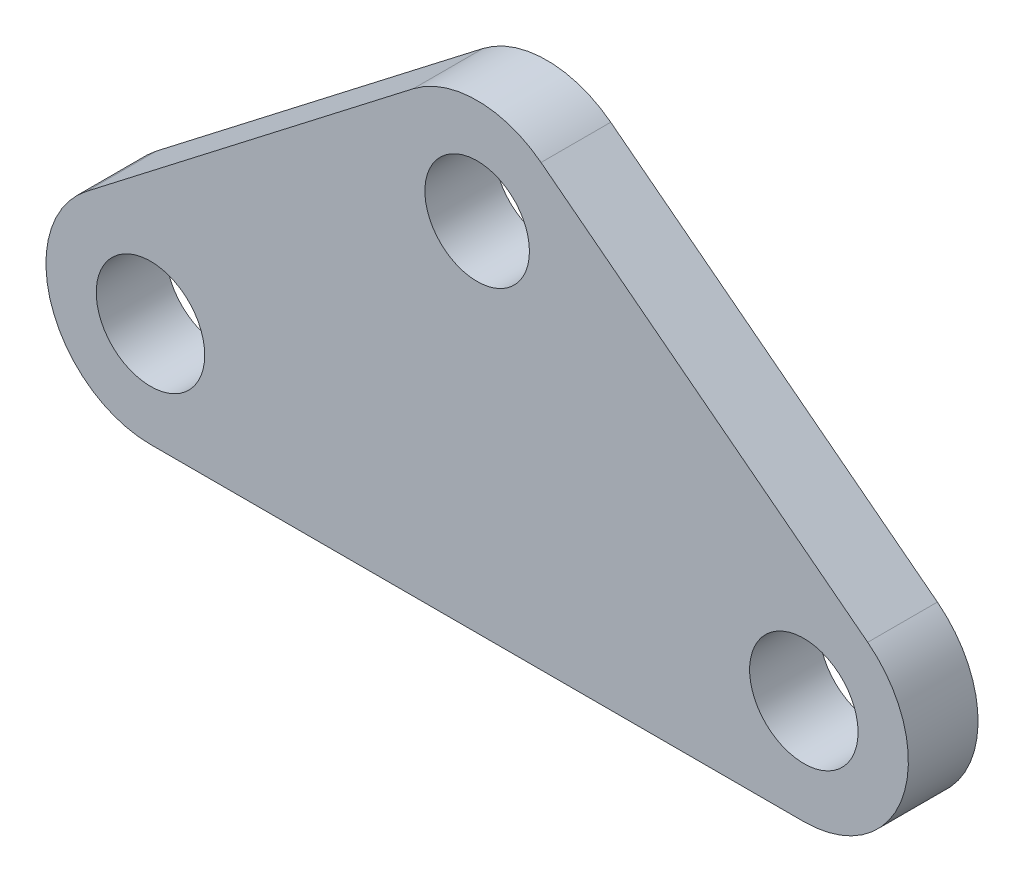
from build123d import *

# Parameters (mm, degrees)
SKETCH1_R           = 4.15
SKETCH1_R_2         = 4
BOSS_EXTRUDE2_DEPTH = 5.333


with BuildPart() as part:
    # Sketch1 → Boss-Extrude2 (new body)
    with BuildSketch(Plane.XY):
        with BuildLine():
            Line((-25, -27.3), (25, -27.3))
            ThreePointArc((25, -27.3), (32.571659689, -21.88262842), (29.888695875, -12.967492389))
            Line((29.888695875, -12.967492389), (4.888695875, 6.332507611))
            ThreePointArc((4.888695875, 6.332507611), (0, 8), (-4.888695875, 6.332507611))
            Line((-4.888695875, 6.332507611), (-29.888695875, -12.967492389))
            ThreePointArc((-29.888695875, -12.967492389), (-32.571659689, -21.88262842), (-25, -27.3))
        make_face()
        with Locations((-25, -19.3)):
            Circle(SKETCH1_R, mode=Mode.SUBTRACT)
        with Locations((25, -19.3)):
            Circle(SKETCH1_R, mode=Mode.SUBTRACT)
        Circle(SKETCH1_R_2, mode=Mode.SUBTRACT)
    extrude(amount=-BOSS_EXTRUDE2_DEPTH)


solid = part.part
